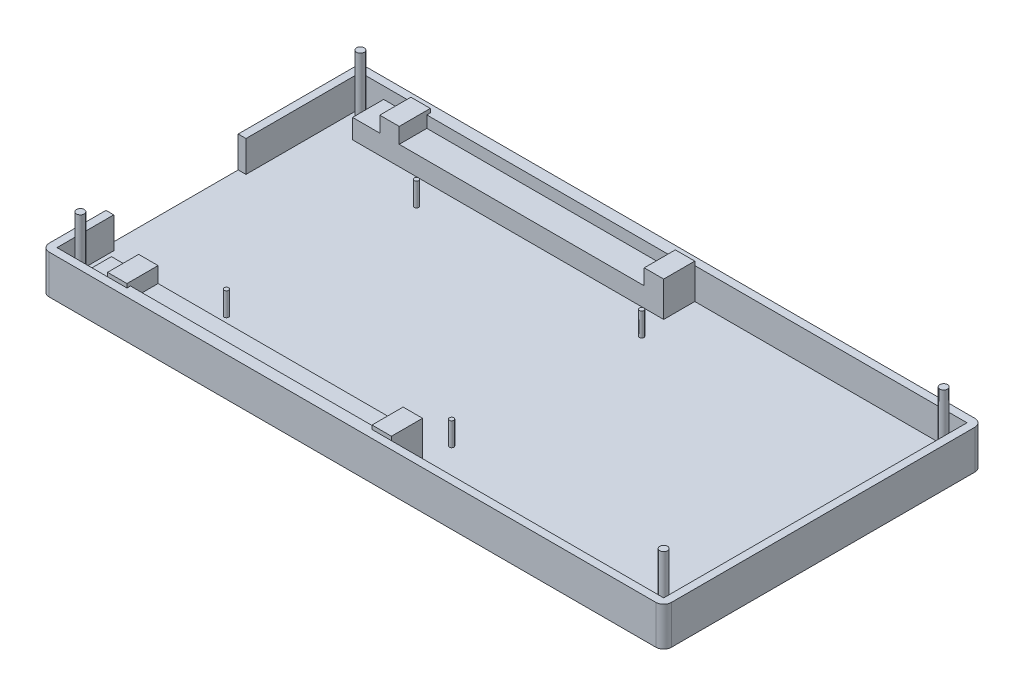
from build123d import *

# Parameters (mm, degrees)
SKETCH1_W           = 160
SKETCH1_H           = 82
BOSS_EXTRUDE1_DEPTH = 10
SHELL1_T            = -2
SKETCH2_R           = 1
BOSS_EXTRUDE2_DEPTH = 16
FILLET1_R           = 2
FILLET2_R           = 2
FILLET3_R           = 2
FILLET4_R           = 2
SKETCH7_R           = 0.575
BOSS_EXTRUDE3_DEPTH = 6
SKETCH10_W          = 34
SKETCH10_H          = 8.029729716
CUT_EXTRUDE1_DEPTH  = 6
SKETCH16_W          = 80
SKETCH16_H          = 8
BOSS_EXTRUDE5_DEPTH = 5
SKETCH18_W          = 5
SKETCH18_H          = 8
BOSS_EXTRUDE6_DEPTH = 4
SKETCH21_W          = 63
SKETCH21_H          = 3
BOSS_EXTRUDE7_DEPTH = 0.9
SKETCH22_W          = 63
SKETCH22_H          = 3
BOSS_EXTRUDE8_DEPTH = 0.9


with BuildPart() as part:
    # Sketch1 → Boss-Extrude1 (new body)
    with BuildSketch(Plane(origin=(0, 0, 0), x_dir=(1, 0, 0), z_dir=(0, 1, 0))):
        Rectangle(SKETCH1_W, SKETCH1_H)
    extrude(amount=BOSS_EXTRUDE1_DEPTH)

    # Shell1
    shell1_openings = [part.faces().sort_by_distance(p)[0] for p in [
        (0, 10, 0),
    ]]
    offset(amount=SHELL1_T, openings=shell1_openings, kind=Kind.INTERSECTION)

    # Sketch2 → Boss-Extrude2 (add)
    with BuildSketch(Plane(origin=(0, 2, 0), x_dir=(1, 0, 0), z_dir=(0, 1, 0))):
        with Locations((-75, 36)):
            Circle(SKETCH2_R)
        with Locations((75, 36)):
            Circle(SKETCH2_R)
        with Locations((75, -36)):
            Circle(SKETCH2_R)
        with Locations((-75, -36)):
            Circle(SKETCH2_R)
    extrude(amount=BOSS_EXTRUDE2_DEPTH)

    # Fillet1
    fillet1_edges = [part.edges().sort_by_distance(p)[0] for p in [
        (-80, 5, 41),
    ]]
    fillet(fillet1_edges, radius=FILLET1_R)

    # Fillet2
    fillet2_edges = [part.edges().sort_by_distance(p)[0] for p in [
        (-80, 5, -41),
    ]]
    fillet(fillet2_edges, radius=FILLET2_R)

    # Fillet3
    fillet3_edges = [part.edges().sort_by_distance(p)[0] for p in [
        (80, 5, -41),
    ]]
    fillet(fillet3_edges, radius=FILLET3_R)

    # Fillet4
    fillet4_edges = [part.edges().sort_by_distance(p)[0] for p in [
        (80, 5, 41),
    ]]
    fillet(fillet4_edges, radius=FILLET4_R)

    # Sketch7 → Boss-Extrude3 (add)
    with BuildSketch(Plane(origin=(0, 2, 0), x_dir=(1, 0, 0), z_dir=(0, 1, 0))):
        with Locations((-49, 24.45)):
            Circle(SKETCH7_R)
        with Locations((-49, -24.43)):
            Circle(SKETCH7_R)
        with Locations((8.9, -24.43)):
            Circle(SKETCH7_R)
        with Locations((8.9, 24.45)):
            Circle(SKETCH7_R)
    extrude(amount=BOSS_EXTRUDE3_DEPTH)

    # Sketch10 → Cut-Extrude1 (cut)
    with BuildSketch(Plane.ZY.offset(80)):
        with Locations((7.4, 6.014864858)):
            Rectangle(SKETCH10_W, SKETCH10_H)
    extrude(amount=-CUT_EXTRUDE1_DEPTH, mode=Mode.SUBTRACT)

    # Sketch16 → Boss-Extrude5 (add)
    with BuildSketch(Plane(origin=(0, 2, 0), x_dir=(1, 0, 0), z_dir=(0, 1, 0))):
        with Locations((-32, 35)):
            Rectangle(SKETCH16_W, SKETCH16_H)
        with Locations((-32, -35)):
            Rectangle(SKETCH16_W, SKETCH16_H)
    extrude(amount=BOSS_EXTRUDE5_DEPTH)

    # Sketch18 → Boss-Extrude6 (add)
    with BuildSketch(Plane(origin=(0, 7, 0), x_dir=(1, 0, 0), z_dir=(0, 1, 0))):
        with Locations((-62.5, 35)):
            Rectangle(SKETCH18_W, SKETCH18_H)
        with Locations((5.5, 35)):
            Rectangle(SKETCH18_W, SKETCH18_H)
        with Locations((5.5, -35)):
            Rectangle(SKETCH18_W, SKETCH18_H)
        with Locations((-62.5, -35)):
            Rectangle(SKETCH18_W, SKETCH18_H)
    extrude(amount=BOSS_EXTRUDE6_DEPTH)

    # Sketch21 → Boss-Extrude7 (add)
    with BuildSketch(Plane.XY.offset(-39)):
        with Locations((-28.5, 8.5)):
            Rectangle(SKETCH21_W, SKETCH21_H)
    extrude(amount=BOSS_EXTRUDE7_DEPTH)

    # Sketch22 → Boss-Extrude8 (add)
    with BuildSketch(Plane(origin=(0, 0, 39), x_dir=(-1, 0, 0), z_dir=(0, 0, -1))):
        with Locations((28.5, 8.5)):
            Rectangle(SKETCH22_W, SKETCH22_H)
    extrude(amount=BOSS_EXTRUDE8_DEPTH)


solid = part.part
